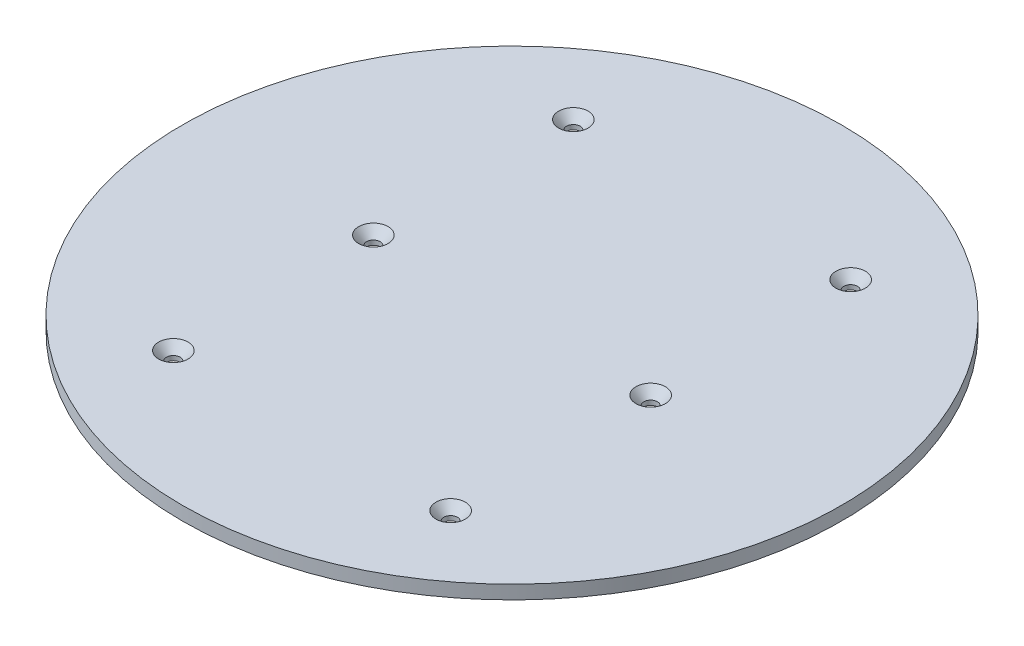
from build123d import *
from OCP.BRepFilletAPI import BRepFilletAPI_MakeChamfer

# Parameters (mm, degrees)
SKETCH1_R           = 72.5
BOSS_EXTRUDE1_DEPTH = 3
SKETCH2_R           = 1.5
CUT_EXTRUDE1_DEPTH  = 103.574363269
CHAMFER1_SIZE       = 2
CHAMFER1_SIZE2      = 1.738573476


with BuildPart() as part:
    # Sketch1 → Boss-Extrude1 (new body)
    with BuildSketch(Plane(origin=(0, 0, 0), x_dir=(1, 0, 0), z_dir=(0, 1, 0))):
        Circle(SKETCH1_R)
    extrude(amount=BOSS_EXTRUDE1_DEPTH)

    # Sketch2 → Cut-Extrude1 (cut, through all)
    with BuildSketch(Plane(origin=(0, 3, 0), x_dir=(1, 0, 0), z_dir=(0, 1, 0))):
        with Locations((-30.5, 44)):
            Circle(SKETCH2_R)
        with Locations((30.5, 44)):
            Circle(SKETCH2_R)
        with Locations((30.5, 0)):
            Circle(SKETCH2_R)
        with Locations((30.5, -44)):
            Circle(SKETCH2_R)
        with Locations((-30.5, -44)):
            Circle(SKETCH2_R)
        with Locations((-30.5, 0)):
            Circle(SKETCH2_R)
    extrude(amount=-CUT_EXTRUDE1_DEPTH, mode=Mode.SUBTRACT)

    # Chamfer1: one chamfer whose edges measure the first distance from different faces: ONE call of the kernel's chamfer builder (chamfer() names one face for all edges)
    chamfer1_edges_1 = [part.edges().sort_by_distance(p)[0] for p in [
        (29, 3, -44),
    ]]
    chamfer1_side_1 = [part.faces().sort_by_distance(p)[0] for p in [
        (29, 1.5, -44),
    ]]
    chamfer1_edges_2 = [part.edges().sort_by_distance(p)[0] for p in [
        (29, 3, 0),
    ]]
    chamfer1_side_2 = [part.faces().sort_by_distance(p)[0] for p in [
        (29, 1.5, 0),
    ]]
    chamfer1_edges_3 = [part.edges().sort_by_distance(p)[0] for p in [
        (29, 3, 44),
    ]]
    chamfer1_side_3 = [part.faces().sort_by_distance(p)[0] for p in [
        (29, 1.5, 44),
    ]]
    chamfer1_edges_4 = [part.edges().sort_by_distance(p)[0] for p in [
        (-32, 3, 44),
    ]]
    chamfer1_side_4 = [part.faces().sort_by_distance(p)[0] for p in [
        (-32, 1.5, 44),
    ]]
    chamfer1_edges_5 = [part.edges().sort_by_distance(p)[0] for p in [
        (-32, 3, 0),
    ]]
    chamfer1_side_5 = [part.faces().sort_by_distance(p)[0] for p in [
        (-32, 1.5, 0),
    ]]
    chamfer1_edges_6 = [part.edges().sort_by_distance(p)[0] for p in [
        (-32, 3, -44),
    ]]
    chamfer1_side_6 = [part.faces().sort_by_distance(p)[0] for p in [
        (-32, 1.5, -44),
    ]]
    chamfer1 = BRepFilletAPI_MakeChamfer(part.part.solid().wrapped)
    for e in chamfer1_edges_1:
        chamfer1.Add(CHAMFER1_SIZE, CHAMFER1_SIZE2, e.wrapped, chamfer1_side_1[0].wrapped)  # the first distance lies on this face
    for e in chamfer1_edges_2:
        chamfer1.Add(CHAMFER1_SIZE, CHAMFER1_SIZE2, e.wrapped, chamfer1_side_2[0].wrapped)  # the first distance lies on this face
    for e in chamfer1_edges_3:
        chamfer1.Add(CHAMFER1_SIZE, CHAMFER1_SIZE2, e.wrapped, chamfer1_side_3[0].wrapped)  # the first distance lies on this face
    for e in chamfer1_edges_4:
        chamfer1.Add(CHAMFER1_SIZE, CHAMFER1_SIZE2, e.wrapped, chamfer1_side_4[0].wrapped)  # the first distance lies on this face
    for e in chamfer1_edges_5:
        chamfer1.Add(CHAMFER1_SIZE, CHAMFER1_SIZE2, e.wrapped, chamfer1_side_5[0].wrapped)  # the first distance lies on this face
    for e in chamfer1_edges_6:
        chamfer1.Add(CHAMFER1_SIZE, CHAMFER1_SIZE2, e.wrapped, chamfer1_side_6[0].wrapped)  # the first distance lies on this face
    add(Compound.cast(chamfer1.Shape()), mode=Mode.REPLACE)


solid = part.part
